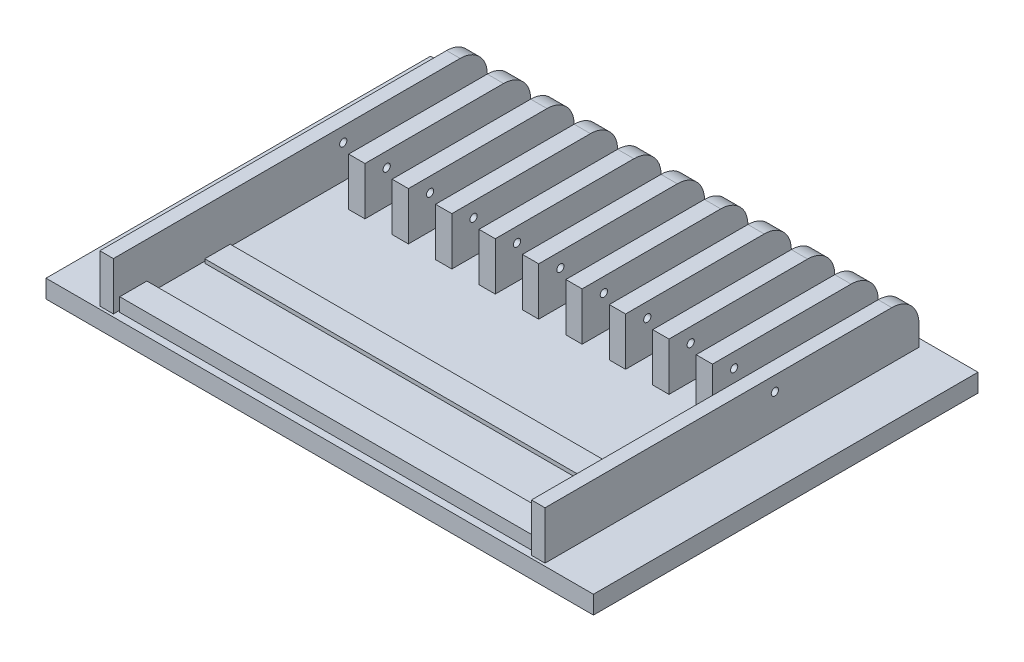
from build123d import *

# Parameters (mm, degrees)
SKETCH1_W           = 605
SKETCH1_H           = 425
BOSS_EXTRUDE1_DEPTH = 20
BOSS_EXTRUDE2_DEPTH = 246
SKETCH3_W           = 30
SKETCH3_H           = 53
CUT_EXTRUDE1_DEPTH  = 522.918815526
SKETCH4_R           = 4
CUT_EXTRUDE2_DEPTH  = 591.607737843
SKETCH5_W           = 230
SKETCH5_H           = 53
CUT_EXTRUDE3_DEPTH  = 220
SKETCH6_W           = 458
SKETCH6_H           = 30
BOSS_EXTRUDE3_DEPTH = 15
SKETCH7_W           = 458
SKETCH7_H           = 28
BOSS_EXTRUDE4_DEPTH = 4.3


with BuildPart() as part:
    # Sketch1 → Boss-Extrude1 (new body)
    with BuildSketch(Plane(origin=(0, 0, 0), x_dir=(1, 0, 0), z_dir=(0, 1, 0))):
        Rectangle(SKETCH1_W, SKETCH1_H)
    extrude(amount=-BOSS_EXTRUDE1_DEPTH)

    # Sketch2 → Boss-Extrude2 (add, symmetric)
    with BuildSketch(Plane(origin=(0, 0, 0), x_dir=(0, 0, -1), z_dir=(1, 0, 0))):
        with BuildLine():
            Line((203.7, 0), (-209.5, 0))
            Line((-209.5, 0), (-209.5, 53))
            Line((-209.5, 53), (173.7, 53))
            ThreePointArc((173.7, 53), (194.913203436, 44.213203436), (203.7, 23))
            Line((203.7, 23), (203.7, 0))
        make_face()
    extrude(amount=BOSS_EXTRUDE2_DEPTH, both=True)

    # Sketch3 → Cut-Extrude1 (cut, through all)
    with BuildSketch(Plane.XY.offset(209.5)):
        with Locations((-216, 26.5)):
            Rectangle(SKETCH3_W, SKETCH3_H)
        with Locations((-168, 26.5)):
            Rectangle(SKETCH3_W, SKETCH3_H)
        with Locations((-120, 26.5)):
            Rectangle(SKETCH3_W, SKETCH3_H)
        with Locations((-72, 26.5)):
            Rectangle(SKETCH3_W, SKETCH3_H)
        with Locations((-24, 26.5)):
            Rectangle(SKETCH3_W, SKETCH3_H)
        with Locations((24, 26.5)):
            Rectangle(SKETCH3_W, SKETCH3_H)
        with Locations((72, 26.5)):
            Rectangle(SKETCH3_W, SKETCH3_H)
        with Locations((120, 26.5)):
            Rectangle(SKETCH3_W, SKETCH3_H)
        with Locations((168, 26.5)):
            Rectangle(SKETCH3_W, SKETCH3_H)
        with Locations((216, 26.5)):
            Rectangle(SKETCH3_W, SKETCH3_H)
    extrude(amount=-CUT_EXTRUDE1_DEPTH, mode=Mode.SUBTRACT)

    # Sketch4 → Cut-Extrude2 (cut, through all)
    with BuildSketch(Plane.ZY.offset(246)):
        with Locations((-44.5, 37)):
            Circle(SKETCH4_R)
    extrude(amount=-CUT_EXTRUDE2_DEPTH, mode=Mode.SUBTRACT)

    # Sketch5 → Cut-Extrude3 (cut, symmetric)
    with BuildSketch(Plane(origin=(0, 0, 0), x_dir=(0, 0, -1), z_dir=(1, 0, 0))):
        with Locations((-94.5, 26.5)):
            Rectangle(SKETCH5_W, SKETCH5_H)
    extrude(amount=CUT_EXTRUDE3_DEPTH, both=True, mode=Mode.SUBTRACT)

    # Sketch6 → Boss-Extrude3 (add)
    with BuildSketch(Plane(origin=(0, 0, 0), x_dir=(1, 0, 0), z_dir=(0, 1, 0))):
        with Locations((0, -189.5)):
            Rectangle(SKETCH6_W, SKETCH6_H)
    extrude(amount=BOSS_EXTRUDE3_DEPTH)

    # Sketch7 → Boss-Extrude4 (add)
    with BuildSketch(Plane(origin=(0, 0, 0), x_dir=(1, 0, 0), z_dir=(0, 1, 0))):
        with Locations((0, -96.5)):
            Rectangle(SKETCH7_W, SKETCH7_H)
    extrude(amount=BOSS_EXTRUDE4_DEPTH)


solid = part.part
